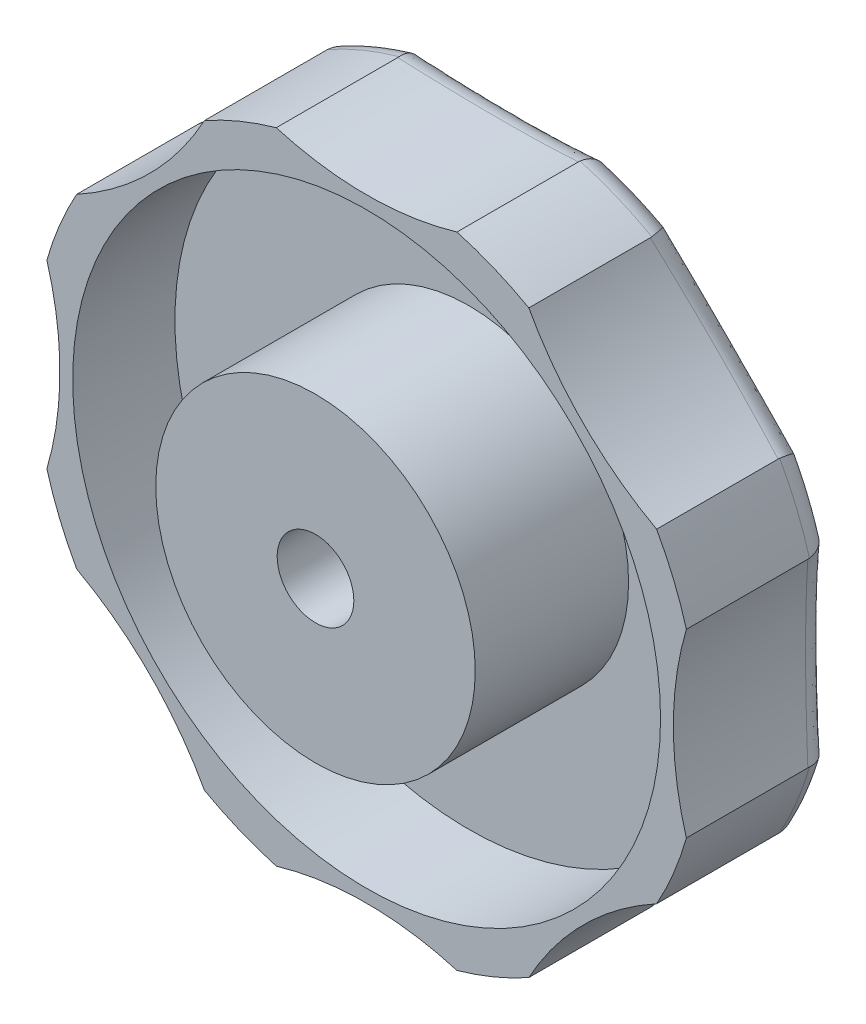
from build123d import *

# Parameters (mm, degrees)
CROQUIS1_R                 = 12.5
CROQUIS1_R_2               = 3
SALIENTE_EXTRUIR1_DEPTH    = 15
CROQUIS2_R                 = 26
SALIENTE_EXTRUIR2_DEPTH    = 3
CROQUIS3_R                 = 26
CROQUIS3_R_2               = 23
SALIENTE_EXTRUIR3_DEPTH    = 8
SALIENTE_EXTRUIR5_DEPTH    = 8
CORTAR_EXTRUIR1_DEPTH      = 39.678159255
CORTAR_EXTRUIR1_DEPTH_BACK = 39.678159255
REDONDEO1_R                = 2


# Read off the part's stored shape, not the designer's step: Cúpula1
with BuildPart() as part:
    # Croquis1 → Saliente-Extruir1 (new body)
    with BuildSketch(Plane.XY):
        Circle(CROQUIS1_R)
        Circle(CROQUIS1_R_2, mode=Mode.SUBTRACT)
    extrude(amount=SALIENTE_EXTRUIR1_DEPTH)

    # Croquis2 → Saliente-Extruir2 (add)
    with BuildSketch(Plane(origin=(0, 0, 0), x_dir=(-1, 0, 0), z_dir=(0, 0, -1))):
        Circle(CROQUIS2_R)
    extrude(amount=-SALIENTE_EXTRUIR2_DEPTH)

    # Cúpula1 outline → Cúpula1 (revolve)
    with BuildSketch(Plane.XZ):
        with BuildLine():
            Line((0, 2.6e-08), (0, -5))
            ThreePointArc((0, -5), (13.238202329, -3.738651927), (26.000000065, 2.6e-08))
            Line((26.000000065, 2.6e-08), (0, 2.6e-08))
        make_face()
    revolve(axis=Axis((0, 0, 0), (0, 0, 1)))

    # Croquis3 → Saliente-Extruir3 (add)
    with BuildSketch(Plane.XY.offset(3)):
        Circle(CROQUIS3_R)
        Circle(CROQUIS3_R_2, mode=Mode.SUBTRACT)
    extrude(amount=SALIENTE_EXTRUIR3_DEPTH)

    # Croquis4 → Saliente-Extruir5 (add)
    with BuildSketch(Plane.XY.offset(3)):
        with BuildLine():
            Line((-2.6, 1.496662955), (2.6, 1.496662955))
            ThreePointArc((2.6, 1.496662955), (0, 3), (-2.6, 1.496662955))
        make_face()
    extrude(amount=SALIENTE_EXTRUIR5_DEPTH)

    # Croquis5 → Cortar-Extruir1 (cut, two sides: drawn at the far end of the back side and taken through both)
    with BuildSketch(Plane.XY.offset(3).offset(-CORTAR_EXTRUIR1_DEPTH_BACK)):
        with BuildLine():
            ThreePointArc((7.069595133, 25.020408163), (0, 24), (-7.069595133, 25.020408163))
            ThreePointArc((-7.069595133, 25.020408163), (0, 26), (7.069595133, 25.020408163))
        make_face()
        with BuildLine():
            ThreePointArc((22.691058939, 12.693141622), (16.970562748, 16.970562748), (12.693141622, 22.691058939))
            ThreePointArc((12.693141622, 22.691058939), (18.384776311, 18.384776311), (22.691058939, 12.693141622))
        make_face()
        with BuildLine():
            ThreePointArc((25.020408163, -7.069595133), (24, 0), (25.020408163, 7.069595133))
            ThreePointArc((25.020408163, 7.069595133), (26, 0), (25.020408163, -7.069595133))
        make_face()
        with BuildLine():
            ThreePointArc((12.693141622, -22.691058939), (16.970562748, -16.970562748), (22.691058939, -12.693141622))
            ThreePointArc((22.691058939, -12.693141622), (18.384776311, -18.384776311), (12.693141622, -22.691058939))
        make_face()
        with BuildLine():
            ThreePointArc((-7.069595133, -25.020408163), (0, -24), (7.069595133, -25.020408163))
            ThreePointArc((7.069595133, -25.020408163), (0, -26), (-7.069595133, -25.020408163))
        make_face()
        with BuildLine():
            ThreePointArc((-22.691058939, -12.693141622), (-16.970562748, -16.970562748), (-12.693141622, -22.691058939))
            ThreePointArc((-12.693141622, -22.691058939), (-18.384776311, -18.384776311), (-22.691058939, -12.693141622))
        make_face()
        with BuildLine():
            ThreePointArc((-25.020408163, 7.069595133), (-24, 0), (-25.020408163, -7.069595133))
            ThreePointArc((-25.020408163, -7.069595133), (-26, 0), (-25.020408163, 7.069595133))
        make_face()
        with BuildLine():
            ThreePointArc((-12.693141622, 22.691058939), (-16.970562748, 16.970562748), (-22.691058939, 12.693141622))
            ThreePointArc((-22.691058939, 12.693141622), (-18.384776311, 18.384776311), (-12.693141622, 22.691058939))
        make_face()
    extrude(amount=CORTAR_EXTRUIR1_DEPTH + CORTAR_EXTRUIR1_DEPTH_BACK, mode=Mode.SUBTRACT)

    # Redondeo1
    redondeo1_edges = [part.edges().sort_by_distance(p)[0] for p in [
        (-16.970562748, 16.970562749, -0.763571113),
        (-24.020867845, 9.949769241, 0),
        (-9.949769241, 24.020867845, 0),
        (9.949769241, 24.020867845, 0),
        (24.020867845, 9.949769241, 0),
        (24.020867845, -9.949769241, 0),
        (9.949769241, -24.020867845, 0),
        (-9.949769241, -24.020867845, 0),
        (-24.020867845, -9.949769241, 0),
        (1e-09, 24, -0.763571114),
        (16.970562749, 16.970562748, -0.763571115),
        (24.259286633, -3.591253546, -0.57038838),
        (16.970562749, -16.970562748, -0.763571115),
        (1e-09, -24, -0.763571114),
        (-16.970562748, -16.970562749, -0.763571113),
        (-24, 0, -0.763571113),
    ]]
    fillet(redondeo1_edges, radius=REDONDEO1_R)


solid = part.part
